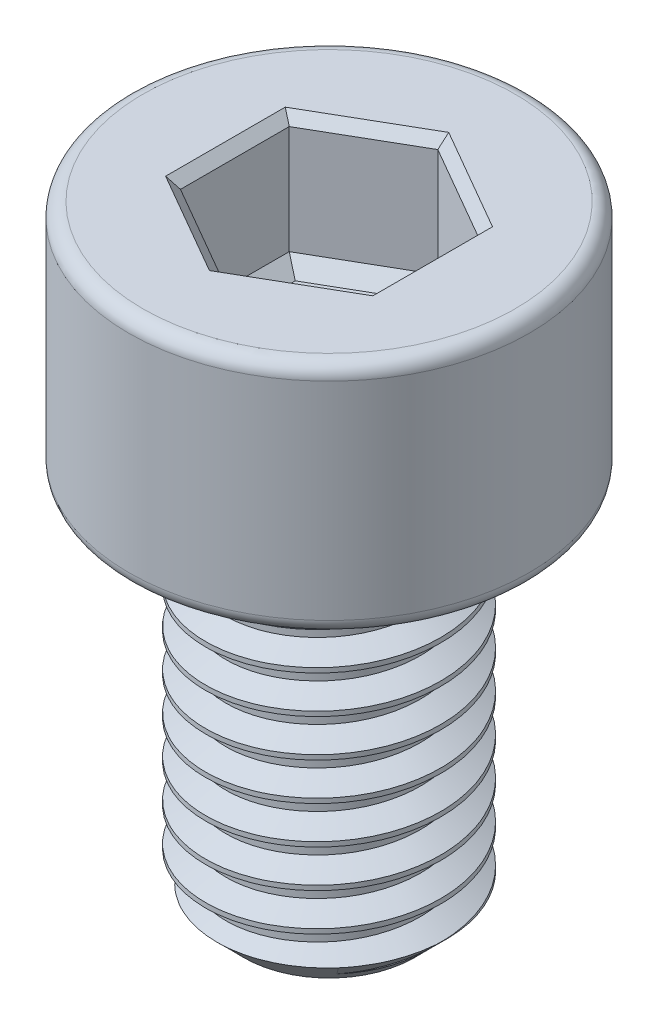
from build123d import *

# Parameters (mm, degrees)
SKETCH1_R           = 2.5
BOSS_EXTRUDE1_DEPTH = 8
THREAD1_PITCH       = 0.8
SKETCH5_R           = 4.25
BOSS_EXTRUDE2_DEPTH = 5
FILLET1_R           = 0.3
CUT_EXTRUDE1_DEPTH  = 2.5
CHAMFER1_SIZE       = 0.2
CUT_EXTRUDE2_DEPTH  = 0.3
CUT_EXTRUDE2_DRAFT  = -45


with BuildPart() as part:
    # Sketch1 → Boss-Extrude1 (new body)
    with BuildSketch(Plane(origin=(0, 0, 0), x_dir=(1, 0, 0), z_dir=(0, 1, 0))):
        with Locations(Location((0, 0, 0), (0, 0, 270))):
            Circle(SKETCH1_R)
    extrude(amount=BOSS_EXTRUDE1_DEPTH)

    # Thread1: the profile of Thread Profile1 profile screwed along a right-hand helix of 11.25 turns, 8 arcs to a turn; built about Z, then put on its axis
    thread1_z = Axis((0, 0, 0), (0, 0, 1))
    thread1_corners = [(2.5003, 0, -0.000173205), (2.5003, 0, 0.700173203), (2.0669873, 0, 0.449999999), (2.0669873, 0, 0.249999999)]
    with BuildLine(mode=Mode.PRIVATE) as thread1_profile:
        Line(thread1_corners[0], thread1_corners[1])
        Line(thread1_corners[1], thread1_corners[2])
        Line(thread1_corners[2], thread1_corners[3])
        Line(thread1_corners[3], thread1_corners[0])
    thread1_cap = Face(thread1_profile.wire())
    thread1_turn_angles = [0, 22.5, 45, 67.5, 90, 112.5, 135, 157.5, 180, 202.5, 225, 247.5, 270, 292.5, 315, 337.5, 360]
    thread1_turn_weights = [1, 0.9238795325112867, 1, 0.9238795325112867, 1, 0.9238795325112867, 1, 0.9238795325112867, 1, 0.9238795325112867, 1, 0.9238795325112867, 1, 0.9238795325112867, 1, 0.9238795325112867, 1]
    thread1_turn_rails = [Edge.make_bspline([Vector(p[0], p[1], 0).rotate(thread1_z, thread1_turn_angles[k]) / thread1_turn_weights[k] + Vector(0, 0, p[2] + THREAD1_PITCH * thread1_turn_angles[k] / 360) for k in range(17)], [0, 0, 0, 1, 1, 2, 2, 3, 3, 4, 4, 5, 5, 6, 6, 7, 7, 8, 8, 8], 2, thread1_turn_weights) for p in thread1_corners]
    thread1_turn_sides = [Face.make_surface_from_curves(thread1_turn_rails[p[0]], thread1_turn_rails[p[1]]) for p in [(0, 1), (1, 2), (2, 3), (3, 0)]]
    thread1_last_angles = [3960, 3982.5, 4005, 4027.5, 4050]
    thread1_last_weights = [1, 0.9238795325112867, 1, 0.9238795325112852, 1]
    thread1_last_rails = [Edge.make_bspline([Vector(p[0], p[1], 0).rotate(thread1_z, thread1_last_angles[k]) / thread1_last_weights[k] + Vector(0, 0, p[2] + THREAD1_PITCH * thread1_last_angles[k] / 360) for k in range(5)], [0, 0, 0, 1, 1, 2, 2, 2], 2, thread1_last_weights) for p in thread1_corners]
    thread1_last_sides = [Face.make_surface_from_curves(thread1_last_rails[p[0]], thread1_last_rails[p[1]]) for p in [(0, 1), (1, 2), (2, 3), (3, 0)]]
    thread1 = Plane(origin=(0, 9, 0), x_dir=(-1, 0, 0), z_dir=(0, -1, 0)) * Solid(Shell([*[p.moved(Location((0, 0, THREAD1_PITCH * i))) for i in range(11) for p in thread1_turn_sides], *thread1_last_sides, thread1_cap, thread1_cap.rotate(thread1_z, 4050).moved(Location((0, 0, THREAD1_PITCH * 4050 / 360)))]))
    add(thread1, mode=Mode.SUBTRACT)

    # Sketch5 → Boss-Extrude2 (add)
    with BuildSketch(Plane(origin=(0, 8, 0), x_dir=(1, 0, 0), z_dir=(0, 1, 0))):
        with Locations(Location((0, 0, 0), (0, 0, 270))):
            Circle(SKETCH5_R)
    extrude(amount=BOSS_EXTRUDE2_DEPTH)

    # Fillet1
    fillet1_edges = [part.edges().sort_by_distance(p)[0] for p in [
        (0, 8, -4.25),
        (0, 13, -4.25),
    ]]
    fillet(fillet1_edges, radius=FILLET1_R)

    # Sketch6 → Cut-Revolve1 (revolve, cut)
    with BuildSketch(Plane.XY, mode=Mode.PRIVATE) as cut_revolve1_sk:
        Polygon((2.51, 0), (2.51, 0.7), (1.81, 0), align=None)
    revolve(cut_revolve1_sk.sketch.rotate(Axis((0, 0, 0), (0, 1, 0)), 318.279472978), axis=Axis((0, 0, 0), (0, 1, 0)), mode=Mode.SUBTRACT)

    # Sketch7 → Cut-Extrude1 (cut)
    with BuildSketch(Plane(origin=(0, 13, 0), x_dir=(1, 0, 0), z_dir=(0, 1, 0))):
        Polygon((0, 2.309401077), (-2, 1.154700538), (-2, -1.154700538), (0, -2.309401077), (2, -1.154700538), (2, 1.154700538), align=None)
    extrude(amount=-CUT_EXTRUDE1_DEPTH, mode=Mode.SUBTRACT)

    # Chamfer1
    chamfer1_edges = [part.edges().sort_by_distance(p)[0] for p in [
        (1, 13, -1.732050808),
        (-1, 13, -1.732050808),
        (-2, 13, 0),
        (-1, 13, 1.732050808),
        (1, 13, 1.732050808),
        (2, 13, 0),
    ]]
    chamfer(chamfer1_edges, length=CHAMFER1_SIZE)


with BuildPart() as cut_extrude2_tool:
    # Sketch8 → Cut-Extrude2 (with draft: the straight prism first)
    with BuildSketch(Plane(origin=(0, 10.5, 0), x_dir=(1, 0, 0), z_dir=(0, 1, 0))):
        Polygon((0, 2.309401077), (-2, 1.154700538), (-2, -1.154700538), (0, -2.309401077), (2, -1.154700538), (2, 1.154700538), align=None)
    extrude(amount=-CUT_EXTRUDE2_DEPTH)
    # Cut-Extrude2: the draft: its side faces are tilted about the plane it starts from
    cut_extrude2_sides = [cut_extrude2_tool.faces().sort_by_distance(p)[0] for p in [
        (-1, 10.35, -1.732050808),
        (-2, 10.35, 0),
        (-1, 10.35, 1.732050808),
        (1, 10.35, 1.732050808),
        (2, 10.35, 0),
        (1, 10.35, -1.732050808),
    ]]
    draft(cut_extrude2_sides, Plane(origin=(0, 10.5, 0), x_dir=(1, 0, 0), z_dir=(0, 1, 0)), CUT_EXTRUDE2_DRAFT)


with BuildPart() as part_1:
    add(part.part)

    # Cut-Extrude2: cut by cut_extrude2_tool
    add(cut_extrude2_tool.part, mode=Mode.SUBTRACT)


solid = part_1.part
